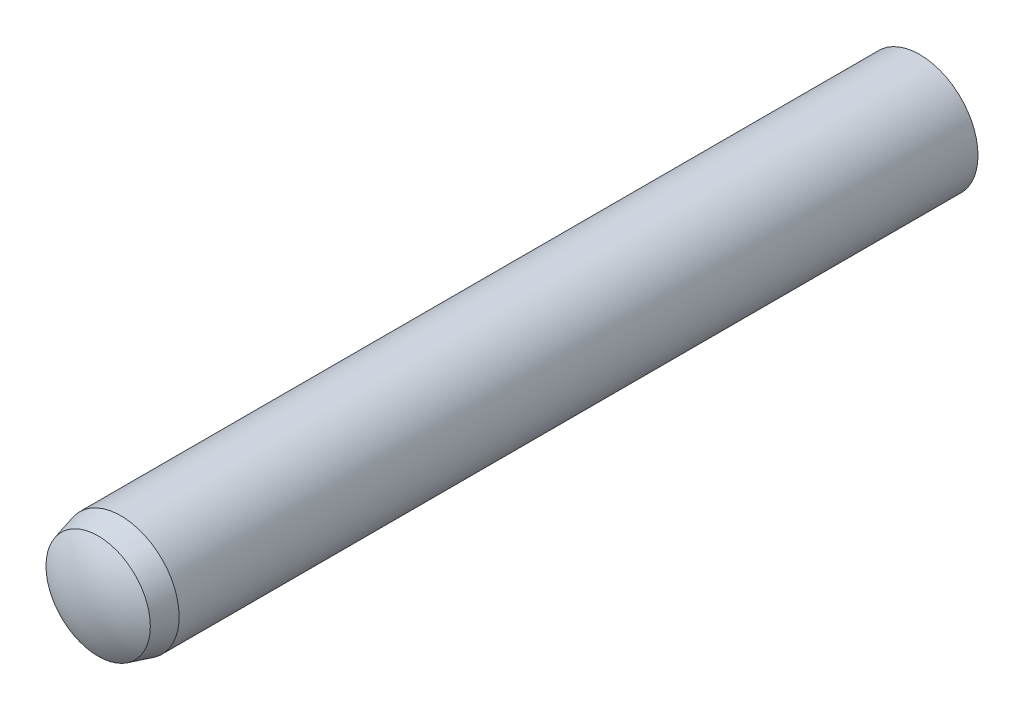
from build123d import *


with BuildPart() as part:
    # Sketch3 → Revolve1 (revolve)
    with BuildSketch(Plane(origin=(0, 0, 0), x_dir=(0, 0, -1), z_dir=(1, 0, 0))):
        with BuildLine():
            Line((-11, 0), (11, 0))
            ThreePointArc((11, 0), (10.885076627, 0.783022988), (10.55, 1.5))
            Line((10.55, 1.5), (-10.025, 1.5))
            Line((-10.025, 1.5), (-10.61, 1.343249722))
            ThreePointArc((-10.61, 1.343249722), (-10.90052754, 0.699360389), (-11, 0))
        make_face()
    revolve(axis=Axis((0, 0, 11), (0, 0, -1)))


solid = part.part
